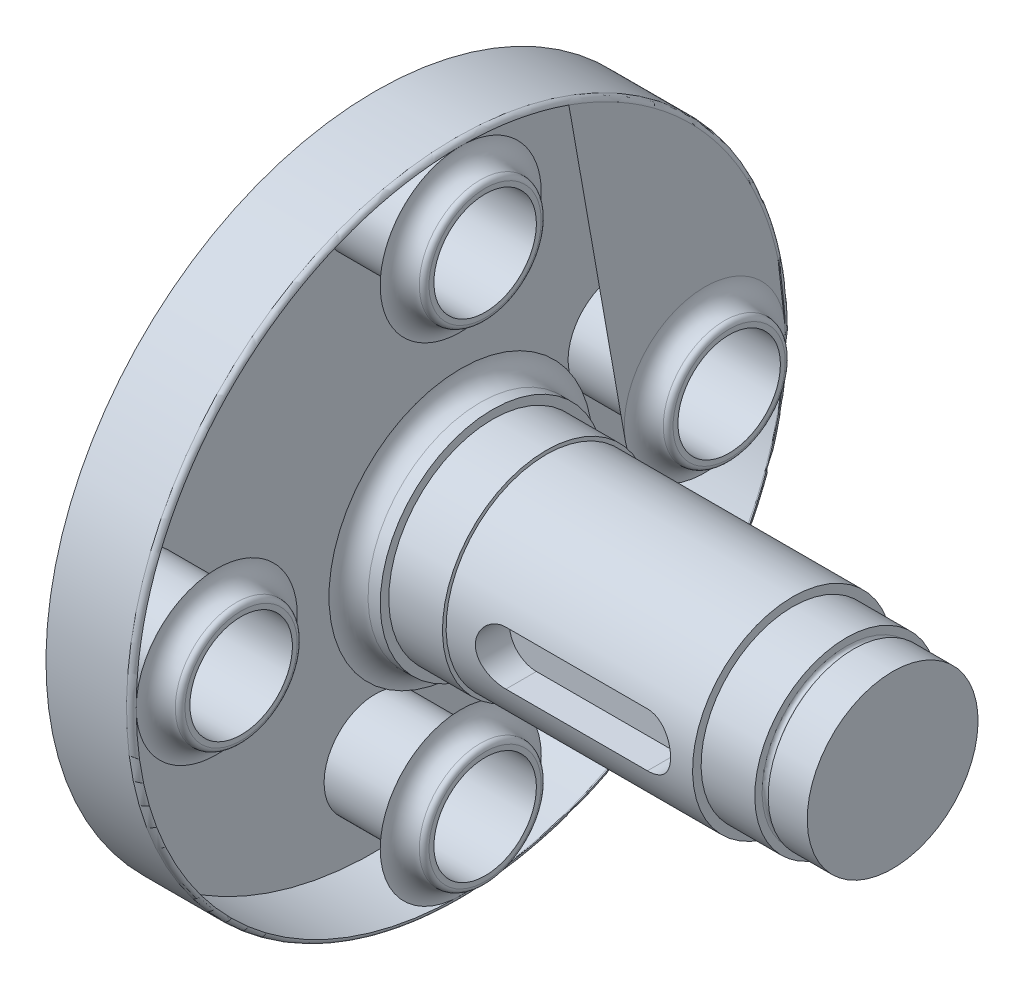
from build123d import *

# Parameters (mm, degrees)
TAGLIO_ESTRUSIONE4_REACH      = 262.344
SCHIZZO3_R                    = 21
ESTRUSIONE_ESTRUSIONE2_START  = 10
SCHIZZO3_5_R                  = 25
SCHIZZO3_5_R_2                = 21
ESTRUSIONE_ESTRUSIONE2_DEPTH  = 10
RIPETIZIONECIRCOLARE1_COUNT   = 4
TAGLIO_ESTRUSIONE5_REACH      = 314.296
TAGLIO_ESTRUSIONE5_END_RADIUS = 41
TAGLIO_ESTRUSIONE5_START      = 27
RACCORDO1_R                   = 1.5
RACCORDO2_R                   = 8
RACCORDO3_R                   = 2


with BuildPart() as part:
    # Schizzo1 → Rivoluzione1 (revolve)
    with BuildSketch(Plane.XY):
        Polygon((0, 135), (35, 135), (35, 46), (48, 46), (48, 42.5), (70, 42.5), (70, 41), (171, 41), (171, 37.5), (193, 37.5), (193, 33), (196, 33), (196, 35), (212, 35), (212, 0), (0, 0), align=None)
    revolve(axis=Axis((333.387398458, 0, 0), (-1, 0, 0)))

    # Schizzo3 → Taglio-Estrusione4 (cut, up to next)
    with BuildSketch(Plane(origin=(35, 0, 0), x_dir=(0, 0, -1), z_dir=(1, 0, 0)), mode=Mode.PRIVATE) as taglio_estrusione4_sk1:
        with Locations(Location((0, 100, 0), (0, 0, 90))):
            Circle(SCHIZZO3_R)
    taglio_estrusione4_tool1 = extrude(taglio_estrusione4_sk1.sketch, amount=-TAGLIO_ESTRUSIONE4_REACH, mode=Mode.PRIVATE) & part.part
    taglio_estrusione4 = taglio_estrusione4_tool1.solids().sort_by_distance((35, 100, 0))[0]
    add(taglio_estrusione4, mode=Mode.SUBTRACT)

    # Schizzo3<5> → Estrusione-Estrusione2 (add)
    with BuildSketch(Plane(origin=(35, 0, 0), x_dir=(0, 0, -1), z_dir=(1, 0, 0)).offset(ESTRUSIONE_ESTRUSIONE2_START)):
        with Locations(Location((0, 100, 0), (0, 0, 90))):
            Circle(SCHIZZO3_5_R)
        with Locations(Location((0, 100, 0), (0, 0, 90))):
            Circle(SCHIZZO3_5_R_2, mode=Mode.SUBTRACT)
    estrusione_estrusione2 = extrude(amount=-ESTRUSIONE_ESTRUSIONE2_DEPTH)

    # RipetizioneCircolare1: Taglio-Estrusione4, Estrusione-Estrusione2 ×4 about axis
    ripetizionecircolare1_axis = Axis((0, 0, 0), (1, 0, 0))
    add([taglio_estrusione4.rotate(ripetizionecircolare1_axis, i * 360 / RIPETIZIONECIRCOLARE1_COUNT) for i in range(1, RIPETIZIONECIRCOLARE1_COUNT)], mode=Mode.SUBTRACT)
    add([estrusione_estrusione2.rotate(ripetizionecircolare1_axis, i * 360 / RIPETIZIONECIRCOLARE1_COUNT) for i in range(1, RIPETIZIONECIRCOLARE1_COUNT)])

    # Taglio-Estrusione5: up to this cylinder (the profile starts inside it)
    taglio_estrusione5_end = Plane(origin=(122, 0, 0), z_dir=(1, 0, 0)) * Cylinder(TAGLIO_ESTRUSIONE5_END_RADIUS, 711.592, mode=Mode.PRIVATE)
    # Schizzo5 → Taglio-Estrusione5 (cut, up to the surface)
    with BuildSketch(Plane.XY.offset(TAGLIO_ESTRUSIONE5_START), mode=Mode.PRIVATE) as taglio_estrusione5_sk1:
        with BuildLine():
            Line((93, 11), (151, 11))
            ThreePointArc((151, 11), (162, 0), (151, -11))
            Line((151, -11), (93, -11))
            ThreePointArc((93, -11), (82, 0), (93, 11))
        make_face()
    taglio_estrusione5_tool1 = extrude(taglio_estrusione5_sk1.sketch, amount=TAGLIO_ESTRUSIONE5_REACH, mode=Mode.PRIVATE) & taglio_estrusione5_end
    add(taglio_estrusione5_tool1.solids().sort_by_distance((122, 0, 27))[0], mode=Mode.SUBTRACT)

    # Raccordo1
    raccordo1_edges = [part.edges().sort_by_distance(p)[0] for p in [
        (196, -33, 0),
        (193, -33, 0),
    ]]
    fillet(raccordo1_edges, radius=RACCORDO1_R - 0.0001)  # a hair under: the kernel refuses the full size

    # Raccordo2
    raccordo2_edges = [part.edges().sort_by_distance(p)[0] for p in [
        (35, -46, 0),
        (35, 75, 0),
        (35, 0, -75),
        (35, -75, 0),
        (35, 0, 75),
    ]]
    fillet(raccordo2_edges, radius=RACCORDO2_R)

    # Raccordo3
    raccordo3_edges = [part.edges().sort_by_distance(p)[0] for p in [
        (35, -135, 0),
        (45, 75, 0),
        (45, 0, -75),
        (45, -75, 0),
        (45, 0, 75),
    ]]
    fillet(raccordo3_edges, radius=RACCORDO3_R - 0.0001)  # a hair under: the kernel refuses the full size


solid = part.part
